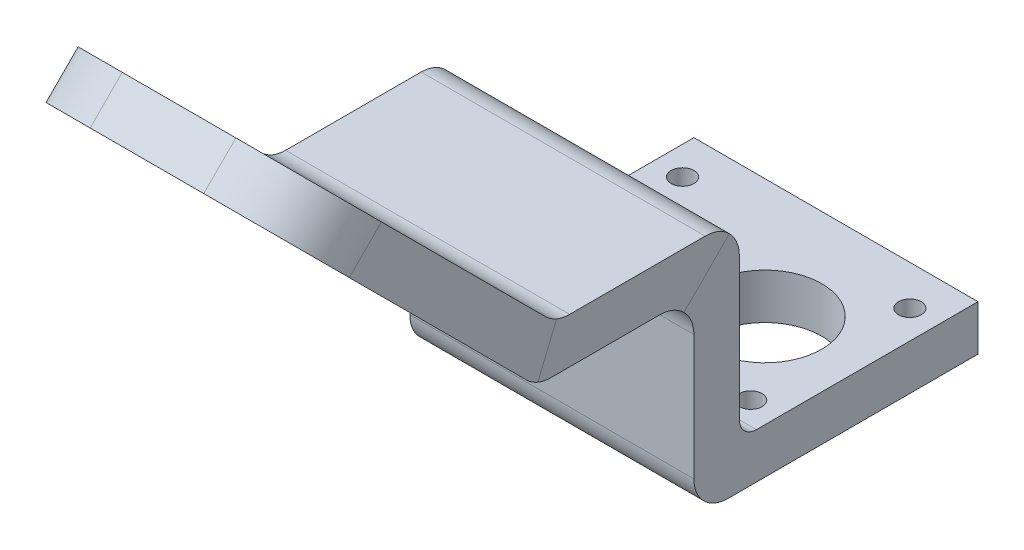
from build123d import *

# Parameters (mm, degrees)
SKETCH1_W           = 50
SKETCH1_H           = 42
BOSS_EXTRUDE1_DEPTH = 8
SKETCH2_R           = 2
SKETCH2_R_2         = 10
CUT_EXTRUDE2_DEPTH  = 12
SKETCH6_W           = 50
SKETCH6_H           = 8
BOSS_EXTRUDE3_DEPTH = 33
SWEEP2_START        = -25
SWEEP2_DEPTH        = 50
FILLET1_R           = 6
FILLET2_R           = 3
SKETCH8_R           = 3
CUT_EXTRUDE3_DEPTH  = 38
FILLET3_R           = 15


# Read off the part's stored shape, not the designer's step: Sweep2
with BuildPart() as part:
    # Sketch1 → Boss-Extrude1 (new body)
    with BuildSketch(Plane(origin=(0, 0, 0), x_dir=(1, 0, 0), z_dir=(0, 1, 0))):
        Rectangle(SKETCH1_W, SKETCH1_H)
    extrude(amount=BOSS_EXTRUDE1_DEPTH)

    # Sketch2 → Cut-Extrude2 (cut)
    with BuildSketch(Plane(origin=(0, 8, 0), x_dir=(1, 0, 0), z_dir=(0, 1, 0))):
        with Locations(Location((-20, 14, 0), (0, 0, 270))):
            Circle(SKETCH2_R)
        with Locations(Location((20, 14, 0), (0, 0, 270))):
            Circle(SKETCH2_R)
        with Locations(Location((20, -14, 0), (0, 0, 270))):
            Circle(SKETCH2_R)
        with Locations(Location((-20, -14, 0), (0, 0, 270))):
            Circle(SKETCH2_R)
        with Locations(Location((8.5, 0, 0), (0, 0, 270))):
            Circle(SKETCH2_R_2)
    extrude(amount=-CUT_EXTRUDE2_DEPTH, mode=Mode.SUBTRACT)

    # Sketch6 → Boss-Extrude3 (add)
    with BuildSketch(Plane.XZ):
        with Locations((0, 25)):
            Rectangle(SKETCH6_W, SKETCH6_H)
    extrude(amount=-BOSS_EXTRUDE3_DEPTH)

    # Sweep2 outline → Sweep2 (add)
    with BuildSketch(Plane.YZ.offset(SWEEP2_START)):
        Polygon((33, 29), (33, 21), (42, 21), (42, 53.343145751), (83.254833996, 94.597979746), (77.597979746, 100.254833996), (34, 56.656854249), (34, 29), align=None)
    extrude(amount=SWEEP2_DEPTH)

    # Fillet1
    fillet1_edges = [part.edges().sort_by_distance(p)[0] for p in [
        (0, 0, 29),
        (0, 34, 56.656854249),
        (0, 42, 53.343145751),
        (0, 34, 29),
        (0, 42, 21),
    ]]
    fillet(fillet1_edges, radius=FILLET1_R)

    # Fillet2
    fillet2_edges = [part.edges().sort_by_distance(p)[0] for p in [
        (0, 8, 21),
    ]]
    fillet(fillet2_edges, radius=FILLET2_R)

    # Sketch8 → Cut-Extrude3 (cut)
    with BuildSketch(Plane(origin=(0, -11.328427125, 11.328427125), x_dir=(1, 0, 0), z_dir=(0, -0.7071067811865465, 0.7071067811865487))):
        with Locations(Location((0, 95.76093065, 0), (0, 0, 270))):
            Circle(SKETCH8_R)
        with Locations(Location((0, 113.76093065, 0), (0, 0, 270))):
            Circle(SKETCH8_R)
    extrude(amount=-CUT_EXTRUDE3_DEPTH, mode=Mode.SUBTRACT)

    # Fillet3
    fillet3_edges = [part.edges().sort_by_distance(p)[0] for p in [
        (-25, 80.426406871, 97.426406871),
        (25, 80.426406871, 97.426406871),
    ]]
    fillet(fillet3_edges, radius=FILLET3_R)


solid = part.part
